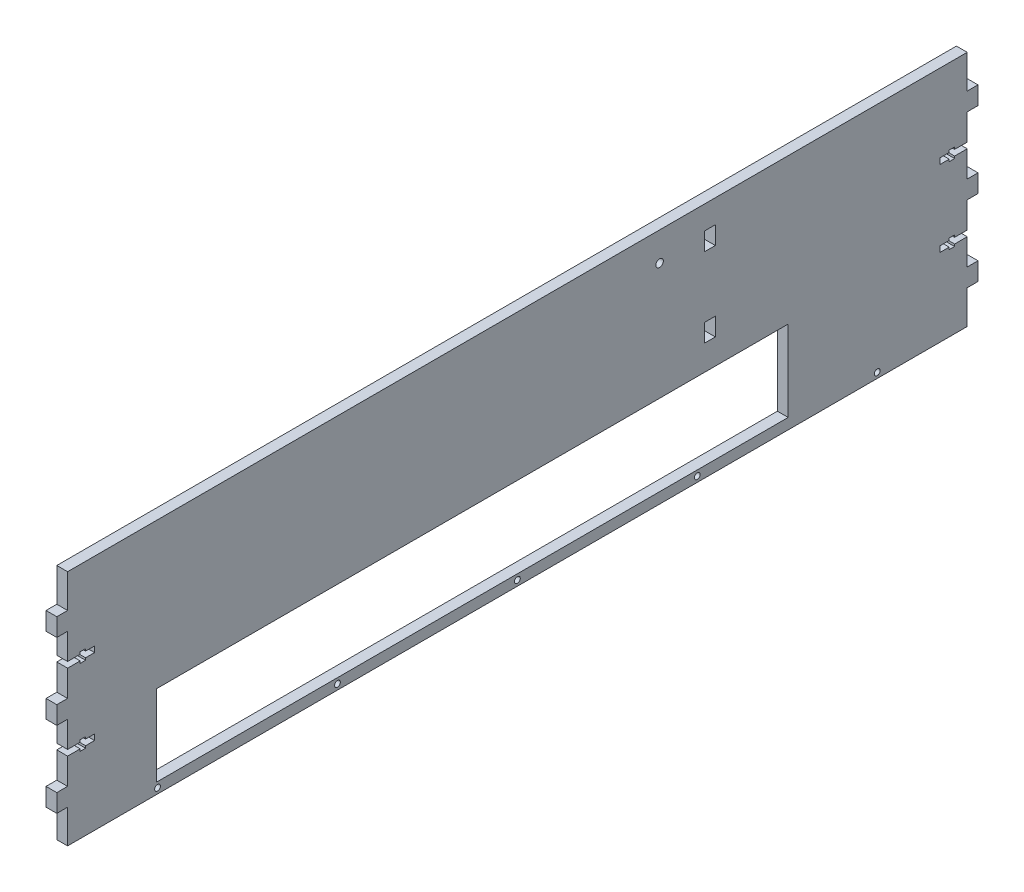
from build123d import *

# Parameters (mm, degrees)
SKETCH1_W           = 500
SKETCH1_H           = 132
BOSS_EXTRUDE1_DEPTH = 6
SKETCH4_W           = 6
SKETCH4_H           = 10
BOSS_EXTRUDE2_DEPTH = 6
CUT_EXTRUDE3_REACH  = 266.439
SKETCH6_W           = 6
SKETCH6_H           = 10
BOSS_EXTRUDE3_DEPTH = 6
CUT_EXTRUDE4_REACH  = 266.439
CUT_EXTRUDE5_REACH  = 266.439
SKETCH8_W           = 351
SKETCH8_H           = 44.95
CUT_EXTRUDE7_REACH  = 266.439
SKETCH10_R          = 1.6
CUT_EXTRUDE8_REACH  = 266.439
SKETCH11_W          = 6
SKETCH11_H          = 10
CUT_EXTRUDE9_REACH  = 266.439
SKETCH12_R          = 2.1


with BuildPart() as part:
    # Sketch1 → Boss-Extrude1 (new body)
    with BuildSketch(Plane(origin=(0, 0, 0), x_dir=(0, 0, -1), z_dir=(1, 0, 0))):
        Rectangle(SKETCH1_W, SKETCH1_H)
    extrude(amount=BOSS_EXTRUDE1_DEPTH)

    # Sketch4 → Boss-Extrude2 (add)
    with BuildSketch(Plane.XY.offset(250)):
        with Locations((3, 42.332128782)):
            Rectangle(SKETCH4_W, SKETCH4_H)
        with Locations((3, 0)):
            Rectangle(SKETCH4_W, SKETCH4_H)
        with Locations((3, -42.332128782)):
            Rectangle(SKETCH4_W, SKETCH4_H)
    extrude(amount=BOSS_EXTRUDE2_DEPTH)

    # Sketch5 → Cut-Extrude3 (cut, up to next)
    with BuildSketch(Plane.ZY, mode=Mode.PRIVATE) as cut_extrude3_sk1:
        Polygon((250, 19.566064391), (250, 22.766064391), (243, 22.766064391), (243, 23.966064391), (240, 23.966064391), (240, 22.766064391), (235, 22.766064391), (235, 19.566064391), (240, 19.566064391), (240, 18.366064391), (243, 18.366064391), (243, 19.566064391), align=None)
    cut_extrude3_tool1 = extrude(cut_extrude3_sk1.sketch, amount=-CUT_EXTRUDE3_REACH, mode=Mode.PRIVATE) & part.part
    # Sketch5 → Cut-Extrude3 (cut, up to next)
    with BuildSketch(Plane.ZY, mode=Mode.PRIVATE) as cut_extrude3_sk2:
        Polygon((243, -19.566064391), (243, -18.366064391), (240, -18.366064391), (240, -19.566064391), (235, -19.566064391), (235, -22.766064391), (240, -22.766064391), (240, -23.966064391), (243, -23.966064391), (243, -22.766064391), (250, -22.766064391), (250, -19.566064391), align=None)
    cut_extrude3_tool2 = extrude(cut_extrude3_sk2.sketch, amount=-CUT_EXTRUDE3_REACH, mode=Mode.PRIVATE) & part.part
    add(cut_extrude3_tool1.solids().sort_by_distance((0, 21.166064, 242.369565))[0], mode=Mode.SUBTRACT)
    add(cut_extrude3_tool2.solids().sort_by_distance((0, -21.166064, 242.369565))[0], mode=Mode.SUBTRACT)

    # Sketch6 → Boss-Extrude3 (add)
    with BuildSketch(Plane(origin=(0, 0, -250), x_dir=(-1, 0, 0), z_dir=(0, 0, -1))):
        with Locations((-3, 42.332128782)):
            Rectangle(SKETCH6_W, SKETCH6_H)
        with Locations((-3, 0)):
            Rectangle(SKETCH6_W, SKETCH6_H)
        with Locations((-3, -42.332128782)):
            Rectangle(SKETCH6_W, SKETCH6_H)
    extrude(amount=BOSS_EXTRUDE3_DEPTH)

    # Sketch7 → Cut-Extrude4 (cut, up to next)
    with BuildSketch(Plane.ZY, mode=Mode.PRIVATE) as cut_extrude4_sk1:
        Polygon((-250, -19.566064391), (-250, -22.766064391), (-243, -22.766064391), (-243, -23.966064391), (-240, -23.966064391), (-240, -22.766064391), (-235, -22.766064391), (-235, -19.566064391), (-240, -19.566064391), (-240, -18.366064391), (-243, -18.366064391), (-243, -19.566064391), align=None)
    cut_extrude4_tool1 = extrude(cut_extrude4_sk1.sketch, amount=-CUT_EXTRUDE4_REACH, mode=Mode.PRIVATE) & part.part
    # Sketch7 → Cut-Extrude4 (cut, up to next)
    with BuildSketch(Plane.ZY, mode=Mode.PRIVATE) as cut_extrude4_sk2:
        Polygon((-250, 22.766064391), (-250, 19.566064391), (-243, 19.566064391), (-243, 18.366064391), (-240, 18.366064391), (-240, 19.566064391), (-235, 19.566064391), (-235, 22.766064391), (-240, 22.766064391), (-240, 23.966064391), (-243, 23.966064391), (-243, 22.766064391), align=None)
    cut_extrude4_tool2 = extrude(cut_extrude4_sk2.sketch, amount=-CUT_EXTRUDE4_REACH, mode=Mode.PRIVATE) & part.part
    add(cut_extrude4_tool1.solids().sort_by_distance((0, -21.166064, -242.369565))[0], mode=Mode.SUBTRACT)
    add(cut_extrude4_tool2.solids().sort_by_distance((0, 21.166064, -242.369565))[0], mode=Mode.SUBTRACT)

    # Sketch8 → Cut-Extrude5 (cut, up to next)
    with BuildSketch(Plane.ZY, mode=Mode.PRIVATE) as cut_extrude5_sk1:
        with Locations((25, -37.525)):
            Rectangle(SKETCH8_W, SKETCH8_H)
    cut_extrude5_tool1 = extrude(cut_extrude5_sk1.sketch, amount=-CUT_EXTRUDE5_REACH, mode=Mode.PRIVATE) & part.part
    add(cut_extrude5_tool1.solids().sort_by_distance((0, -37.525, 25))[0], mode=Mode.SUBTRACT)

    # Sketch10 → Cut-Extrude7 (cut, up to next)
    with BuildSketch(Plane(origin=(6, 0, 0), x_dir=(0, 0, -1), z_dir=(1, 0, 0)), mode=Mode.PRIVATE) as cut_extrude7_sk1:
        with Locations((0, -63)):
            Circle(SKETCH10_R)
    cut_extrude7_tool1 = extrude(cut_extrude7_sk1.sketch, amount=-CUT_EXTRUDE7_REACH, mode=Mode.PRIVATE) & part.part
    # Sketch10 → Cut-Extrude7 (cut, up to next)
    with BuildSketch(Plane(origin=(6, 0, 0), x_dir=(0, 0, -1), z_dir=(1, 0, 0)), mode=Mode.PRIVATE) as cut_extrude7_sk2:
        with Locations((100, -63)):
            Circle(SKETCH10_R)
    cut_extrude7_tool2 = extrude(cut_extrude7_sk2.sketch, amount=-CUT_EXTRUDE7_REACH, mode=Mode.PRIVATE) & part.part
    # Sketch10 → Cut-Extrude7 (cut, up to next)
    with BuildSketch(Plane(origin=(6, 0, 0), x_dir=(0, 0, -1), z_dir=(1, 0, 0)), mode=Mode.PRIVATE) as cut_extrude7_sk3:
        with Locations((200, -63)):
            Circle(SKETCH10_R)
    cut_extrude7_tool3 = extrude(cut_extrude7_sk3.sketch, amount=-CUT_EXTRUDE7_REACH, mode=Mode.PRIVATE) & part.part
    # Sketch10 → Cut-Extrude7 (cut, up to next)
    with BuildSketch(Plane(origin=(6, 0, 0), x_dir=(0, 0, -1), z_dir=(1, 0, 0)), mode=Mode.PRIVATE) as cut_extrude7_sk4:
        with Locations((-100, -63)):
            Circle(SKETCH10_R)
    cut_extrude7_tool4 = extrude(cut_extrude7_sk4.sketch, amount=-CUT_EXTRUDE7_REACH, mode=Mode.PRIVATE) & part.part
    # Sketch10 → Cut-Extrude7 (cut, up to next)
    with BuildSketch(Plane(origin=(6, 0, 0), x_dir=(0, 0, -1), z_dir=(1, 0, 0)), mode=Mode.PRIVATE) as cut_extrude7_sk5:
        with Locations((-200, -63)):
            Circle(SKETCH10_R)
    cut_extrude7_tool5 = extrude(cut_extrude7_sk5.sketch, amount=-CUT_EXTRUDE7_REACH, mode=Mode.PRIVATE) & part.part
    add(cut_extrude7_tool1.solids().sort_by_distance((6, -63, 0))[0], mode=Mode.SUBTRACT)
    add(cut_extrude7_tool2.solids().sort_by_distance((6, -63, -100))[0], mode=Mode.SUBTRACT)
    add(cut_extrude7_tool3.solids().sort_by_distance((6, -63, -200))[0], mode=Mode.SUBTRACT)
    add(cut_extrude7_tool4.solids().sort_by_distance((6, -63, 100))[0], mode=Mode.SUBTRACT)
    add(cut_extrude7_tool5.solids().sort_by_distance((6, -63, 200))[0], mode=Mode.SUBTRACT)

    # Sketch11 → Cut-Extrude8 (cut, up to next)
    with BuildSketch(Plane(origin=(6, 0, 0), x_dir=(0, 0, -1), z_dir=(1, 0, 0)), mode=Mode.PRIVATE) as cut_extrude8_sk1:
        with Locations((107, 48)):
            Rectangle(SKETCH11_W, SKETCH11_H)
    cut_extrude8_tool1 = extrude(cut_extrude8_sk1.sketch, amount=-CUT_EXTRUDE8_REACH, mode=Mode.PRIVATE) & part.part
    # Sketch11 → Cut-Extrude8 (cut, up to next)
    with BuildSketch(Plane(origin=(6, 0, 0), x_dir=(0, 0, -1), z_dir=(1, 0, 0)), mode=Mode.PRIVATE) as cut_extrude8_sk2:
        with Locations((107, 4)):
            Rectangle(SKETCH11_W, SKETCH11_H)
    cut_extrude8_tool2 = extrude(cut_extrude8_sk2.sketch, amount=-CUT_EXTRUDE8_REACH, mode=Mode.PRIVATE) & part.part
    add(cut_extrude8_tool1.solids().sort_by_distance((6, 48, -107))[0], mode=Mode.SUBTRACT)
    add(cut_extrude8_tool2.solids().sort_by_distance((6, 4, -107))[0], mode=Mode.SUBTRACT)

    # Sketch12 → Cut-Extrude9 (cut, up to next)
    with BuildSketch(Plane.ZY, mode=Mode.PRIVATE) as cut_extrude9_sk1:
        with Locations((-79, 50)):
            Circle(SKETCH12_R)
    cut_extrude9_tool1 = extrude(cut_extrude9_sk1.sketch, amount=-CUT_EXTRUDE9_REACH, mode=Mode.PRIVATE) & part.part
    add(cut_extrude9_tool1.solids().sort_by_distance((0, 50, -79))[0], mode=Mode.SUBTRACT)


solid = part.part
